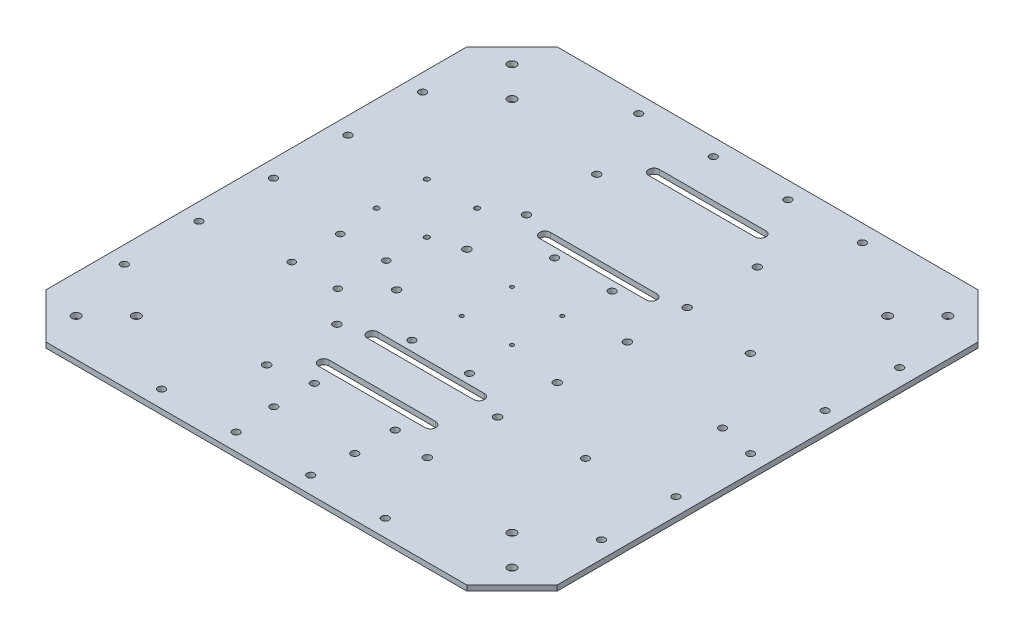
from build123d import *

# Parameters (mm, degrees)
BOSS_EXTRUDE1_DEPTH = 3.175
SKETCH2_R           = 2.159
CUT_EXTRUDE1_DEPTH  = 297.247830215
CUT_EXTRUDE2_DEPTH  = 297.247830215
SKETCH7_R           = 1.524
CUT_EXTRUDE3_DEPTH  = 297.247830215
SKETCH10_R          = 2.159
CUT_EXTRUDE6_DEPTH  = 297.247830215
SKETCH9_R           = 2.032
CUT_EXTRUDE5_DEPTH  = 297.247830215
SKETCH13_R          = 1.1
CUT_EXTRUDE8_DEPTH  = 297.247830215
SKETCH14_R          = 2.54
CUT_EXTRUDE9_DEPTH  = 297.247830215
SKETCH15_R          = 2.159
CUT_EXTRUDE10_DEPTH = 297.247830215
SKETCH16_R          = 2.159
CUT_EXTRUDE11_DEPTH = 297.247830215
SKETCH17_R          = 2.2225
CUT_EXTRUDE13_DEPTH = 297.247830215


with BuildPart() as part:
    # Sketch1 → Boss-Extrude1 (new body)
    with BuildSketch(Plane(origin=(0, 0, 0), x_dir=(1, 0, 0), z_dir=(0, 1, 0))):
        Polygon((-94.345284264, 72.258976948), (-121.286052627, 45.318208585), (-121.286052627, -205.600254688), (-94.345284264, -232.541023052), (156.573179009, -232.541023052), (183.513947373, -205.600254688), (183.513947373, 45.318208585), (156.573179009, 72.258976948), align=None)
    extrude(amount=BOSS_EXTRUDE1_DEPTH)

    # Sketch2 → Cut-Extrude1 (cut, through all)
    with BuildSketch(Plane(origin=(0, 3.175, 0), x_dir=(1, 0, 0), z_dir=(0, 1, 0))):
        with Locations((13.841947373, -37.469023052)):
            Circle(SKETCH2_R)
        with Locations((48.131947373, -37.469023052)):
            Circle(SKETCH2_R)
        with Locations((13.841947373, -122.559023052)):
            Circle(SKETCH2_R)
        with Locations((48.131947373, -122.559023052)):
            Circle(SKETCH2_R)
    extrude(amount=-CUT_EXTRUDE1_DEPTH, mode=Mode.SUBTRACT)

    # Sketch4 → Cut-Extrude2 (cut, through all)
    with BuildSketch(Plane(origin=(0, 3.175, 0), x_dir=(1, 0, 0), z_dir=(0, 1, 0))):
        with BuildLine():
            Line((-0.636052627, 39.468976948), (62.863947373, 39.468976948))
            ThreePointArc((62.863947373, 39.468976948), (66.038947373, 36.293976948), (62.863947373, 33.118976948))
            Line((62.863947373, 33.118976948), (-0.636052627, 33.118976948))
            ThreePointArc((-0.636052627, 33.118976948), (-3.811052627, 36.293976948), (-0.636052627, 39.468976948))
        make_face()
        with BuildLine():
            Line((-0.636052627, -25.531023052), (62.863947373, -25.531023052))
            ThreePointArc((62.863947373, -25.531023052), (66.038947373, -28.706023052), (62.863947373, -31.881023052))
            Line((62.863947373, -31.881023052), (-0.636052627, -31.881023052))
            ThreePointArc((-0.636052627, -31.881023052), (-3.811052627, -28.706023052), (-0.636052627, -25.531023052))
        make_face()
        with BuildLine():
            Line((-0.636052627, -128.401023052), (62.863947373, -128.401023052))
            ThreePointArc((62.863947373, -128.401023052), (66.038947373, -131.576023052), (62.863947373, -134.751023052))
            Line((62.863947373, -134.751023052), (-0.636052627, -134.751023052))
            ThreePointArc((-0.636052627, -134.751023052), (-3.811052627, -131.576023052), (-0.636052627, -128.401023052))
        make_face()
        with BuildLine():
            Line((-0.636052627, -157.401023052), (62.863947373, -157.401023052))
            ThreePointArc((62.863947373, -157.401023052), (66.038947373, -160.576023052), (62.863947373, -163.751023052))
            Line((62.863947373, -163.751023052), (-0.636052627, -163.751023052))
            ThreePointArc((-0.636052627, -163.751023052), (-3.811052627, -160.576023052), (-0.636052627, -157.401023052))
        make_face()
    extrude(amount=-CUT_EXTRUDE2_DEPTH, mode=Mode.SUBTRACT)

    # Sketch7 → Cut-Extrude3 (cut, through all)
    with BuildSketch(Plane(origin=(0, 3.175, 0), x_dir=(1, 0, 0), z_dir=(0, 1, 0))):
        with Locations((-34.926052627, -34.929023052)):
            Circle(SKETCH7_R)
        with Locations((-34.926052627, -64.901023052)):
            Circle(SKETCH7_R)
        with Locations((-64.898052627, -64.901023052)):
            Circle(SKETCH7_R)
        with Locations((-64.898052627, -34.929023052)):
            Circle(SKETCH7_R)
    extrude(amount=-CUT_EXTRUDE3_DEPTH, mode=Mode.SUBTRACT)

    # Sketch10 → Cut-Extrude6 (cut, through all)
    with BuildSketch(Plane.XZ):
        with Locations((6.983947373, 198.041023052)):
            Circle(SKETCH10_R)
        with Locations((55.243947373, 198.041023052)):
            Circle(SKETCH10_R)
        with Locations((6.983947373, 173.911023052)):
            Circle(SKETCH10_R)
        with Locations((55.243947373, 173.911023052)):
            Circle(SKETCH10_R)
    extrude(amount=-CUT_EXTRUDE6_DEPTH, mode=Mode.SUBTRACT)

    # Sketch9 → Cut-Extrude5 (cut, through all)
    with BuildSketch(Plane(origin=(0, 0, 0), x_dir=(-1, 0, 0), z_dir=(0, -1, 0))):
        with Locations((62.358052627, -117.987023052)):
            Circle(SKETCH9_R)
        with Locations((34.926052627, -117.987023052)):
            Circle(SKETCH9_R)
        with Locations((62.358052627, -89.031023052)):
            Circle(SKETCH9_R)
        with Locations((34.926052627, -89.031023052)):
            Circle(SKETCH9_R)
    extrude(amount=-CUT_EXTRUDE5_DEPTH, mode=Mode.SUBTRACT)

    # Sketch13 → Cut-Extrude8 (cut, through all)
    with BuildSketch(Plane.XZ):
        with Locations((16.113947373, 95.141023052)):
            Circle(SKETCH13_R)
        with Locations((16.113947373, 65.141023052)):
            Circle(SKETCH13_R)
        with Locations((46.113947373, 65.141023052)):
            Circle(SKETCH13_R)
        with Locations((46.113947373, 95.141023052)):
            Circle(SKETCH13_R)
    extrude(amount=-CUT_EXTRUDE8_DEPTH, mode=Mode.SUBTRACT)

    # Sketch14 → Cut-Extrude9 (cut, through all)
    with BuildSketch(Plane.XZ):
        with Locations((-98.835412325, 210.090382749)):
            Circle(SKETCH14_R)
        with Locations((-80.874900083, 192.129870507)):
            Circle(SKETCH14_R)
        with Locations((143.102794828, 192.129870507)):
            Circle(SKETCH14_R)
        with Locations((161.06330707, 210.090382749)):
            Circle(SKETCH14_R)
        with Locations((-98.835412325, -49.808336646)):
            Circle(SKETCH14_R)
        with Locations((-80.874900083, -31.847824404)):
            Circle(SKETCH14_R)
        with Locations((161.06330707, -49.808336646)):
            Circle(SKETCH14_R)
        with Locations((143.102794828, -31.847824404)):
            Circle(SKETCH14_R)
    extrude(amount=-CUT_EXTRUDE9_DEPTH, mode=Mode.SUBTRACT)

    # Sketch15 → Cut-Extrude10 (cut, through all)
    with BuildSketch(Plane.XZ):
        with Locations((8.888947373, 222.381023052)):
            Circle(SKETCH15_R)
        with Locations((-35.561052627, 222.381023052)):
            Circle(SKETCH15_R)
        with Locations((-111.126052627, 80.141023052)):
            Circle(SKETCH15_R)
        with Locations((-111.126052627, 124.591023052)):
            Circle(SKETCH15_R)
        with Locations((-111.126052627, 169.041023052)):
            Circle(SKETCH15_R)
        with Locations((173.353947373, 169.041023052)):
            Circle(SKETCH15_R)
        with Locations((173.353947373, 124.591023052)):
            Circle(SKETCH15_R)
        with Locations((173.353947373, 80.141023052)):
            Circle(SKETCH15_R)
        with Locations((97.788947373, 222.381023052)):
            Circle(SKETCH15_R)
        with Locations((53.338947373, 222.381023052)):
            Circle(SKETCH15_R)
        with Locations((53.338947373, -62.098976948)):
            Circle(SKETCH15_R)
        with Locations((97.788947373, -62.098976948)):
            Circle(SKETCH15_R)
        with Locations((173.353947373, 35.691023052)):
            Circle(SKETCH15_R)
        with Locations((173.353947373, -8.758976948)):
            Circle(SKETCH15_R)
        with Locations((-111.126052627, -8.758976948)):
            Circle(SKETCH15_R)
        with Locations((-111.126052627, 35.691023052)):
            Circle(SKETCH15_R)
        with Locations((-35.561052627, -62.098976948)):
            Circle(SKETCH15_R)
        with Locations((8.888947373, -62.098976948)):
            Circle(SKETCH15_R)
    extrude(amount=-CUT_EXTRUDE10_DEPTH, mode=Mode.SUBTRACT)

    # Sketch16 → Cut-Extrude11 (cut, through all)
    with BuildSketch(Plane(origin=(0, 0, 0), x_dir=(-1, 0, 0), z_dir=(0, -1, 0))):
        with Locations((-126.617947373, -131.830023052)):
            Circle(SKETCH16_R)
        with Locations((-121.537947373, -28.452023052)):
            Circle(SKETCH16_R)
        with Locations((-151.763947373, -75.274023052)):
            Circle(SKETCH16_R)
    extrude(amount=-CUT_EXTRUDE11_DEPTH, mode=Mode.SUBTRACT)

    # Sketch17 → Cut-Extrude13 (cut, through all)
    with BuildSketch(Plane(origin=(0, 3.175, 0), x_dir=(1, 0, 0), z_dir=(0, 1, 0))):
        with Locations((78.992947373, -178.566023052)):
            Circle(SKETCH17_R)
        with Locations((-16.765052627, -178.566023052)):
            Circle(SKETCH17_R)
        with Locations((78.992947373, -136.656023052)):
            Circle(SKETCH17_R)
        with Locations((-16.765052627, -136.656023052)):
            Circle(SKETCH17_R)
        with Locations((78.992947373, -101.096023052)):
            Circle(SKETCH17_R)
        with Locations((-16.765052627, -101.096023052)):
            Circle(SKETCH17_R)
        with Locations((78.992947373, -59.186023052)):
            Circle(SKETCH17_R)
        with Locations((-16.765052627, -59.186023052)):
            Circle(SKETCH17_R)
        with Locations((78.992947373, -23.626023052)):
            Circle(SKETCH17_R)
        with Locations((-16.765052627, -23.626023052)):
            Circle(SKETCH17_R)
        with Locations((78.992947373, 18.283976948)):
            Circle(SKETCH17_R)
        with Locations((-16.765052627, 18.283976948)):
            Circle(SKETCH17_R)
    extrude(amount=-CUT_EXTRUDE13_DEPTH, mode=Mode.SUBTRACT)


solid = part.part
